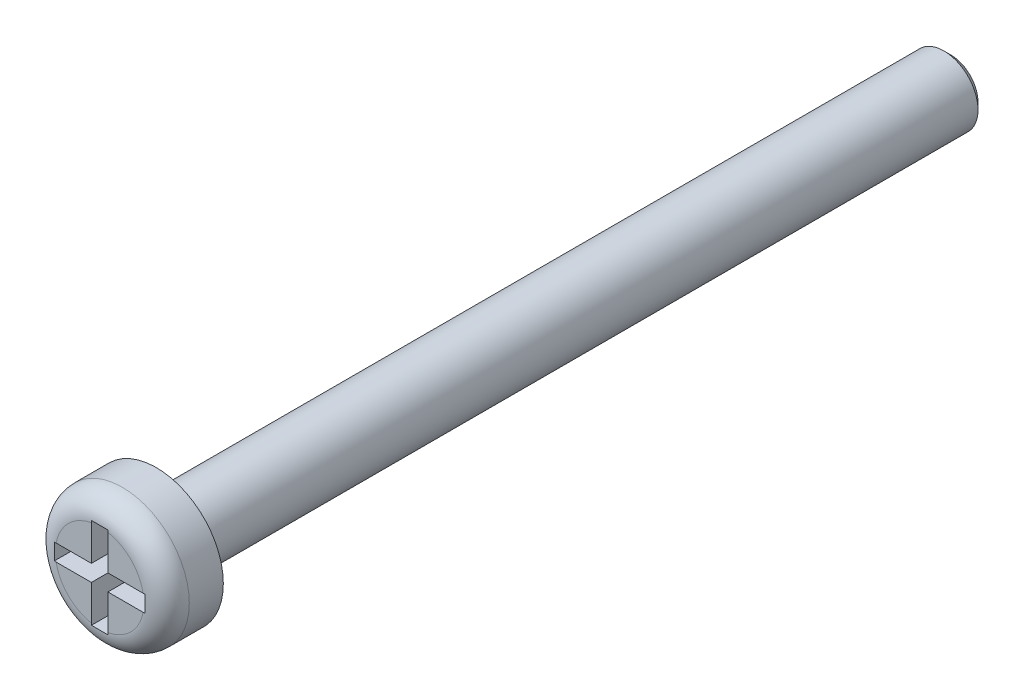
from build123d import *

# Parameters (mm, degrees)
SKETCH1_R           = 2.95
BOSS_EXTRUDE1_DEPTH = 2.5
SKETCH2_R           = 1.5
BOSS_EXTRUDE2_DEPTH = 35
CHAMFER1_SIZE       = 0.3
CUT_EXTRUDE1_DEPTH  = 2
FILLET1_R           = 1


with BuildPart() as part:
    # Sketch1 → Boss-Extrude1 (new body)
    with BuildSketch(Plane.XY):
        Circle(SKETCH1_R)
    extrude(amount=BOSS_EXTRUDE1_DEPTH)

    # Sketch2 → Boss-Extrude2 (add)
    with BuildSketch(Plane(origin=(0, 0, 0), x_dir=(-1, 0, 0), z_dir=(0, 0, -1))):
        with Locations(Location((0, 0, 0), (0, 0, 180))):
            Circle(SKETCH2_R)
    extrude(amount=BOSS_EXTRUDE2_DEPTH)

    # Chamfer1
    chamfer1_edges = [part.edges().sort_by_distance(p)[0] for p in [
        (-1.5, 0, -35),
    ]]
    chamfer(chamfer1_edges, length=CHAMFER1_SIZE)

    # Sketch3 → Cut-Extrude1 (cut)
    with BuildSketch(Plane.XY.offset(2.5)):
        Polygon((0.363589324, 0.363589324), (2, 0.363589324), (2, -0.363589324), (0.363589324, -0.363589324), (0.363589324, -2), (-0.363589324, -2), (-0.363589324, -0.363589324), (-2, -0.363589324), (-2, 0.363589324), (-0.363589324, 0.363589324), (-0.363589324, 2), (0.363589324, 2), align=None)
    extrude(amount=-CUT_EXTRUDE1_DEPTH, mode=Mode.SUBTRACT)

    # Fillet1
    # the kernel refuses this fillet: 1 mm, written as the material it takes off along each edge
    with BuildSketch(Plane(origin=(0, 0, 2.5), x_dir=(1, 0, 0), z_dir=(0, -1, 0))) as fillet1_piece_1:
        with BuildLine():
            CenterArc((2.95 - FILLET1_R, -FILLET1_R), FILLET1_R, 0, 90)
            Line((2.95 - FILLET1_R, 0), (2.95, 0))
            Line((2.95, 0), (2.95, -FILLET1_R))
        make_face()
    revolve(axis=Axis((0, 0, 2.5), (0, 0, 1)), mode=Mode.SUBTRACT)


solid = part.part
